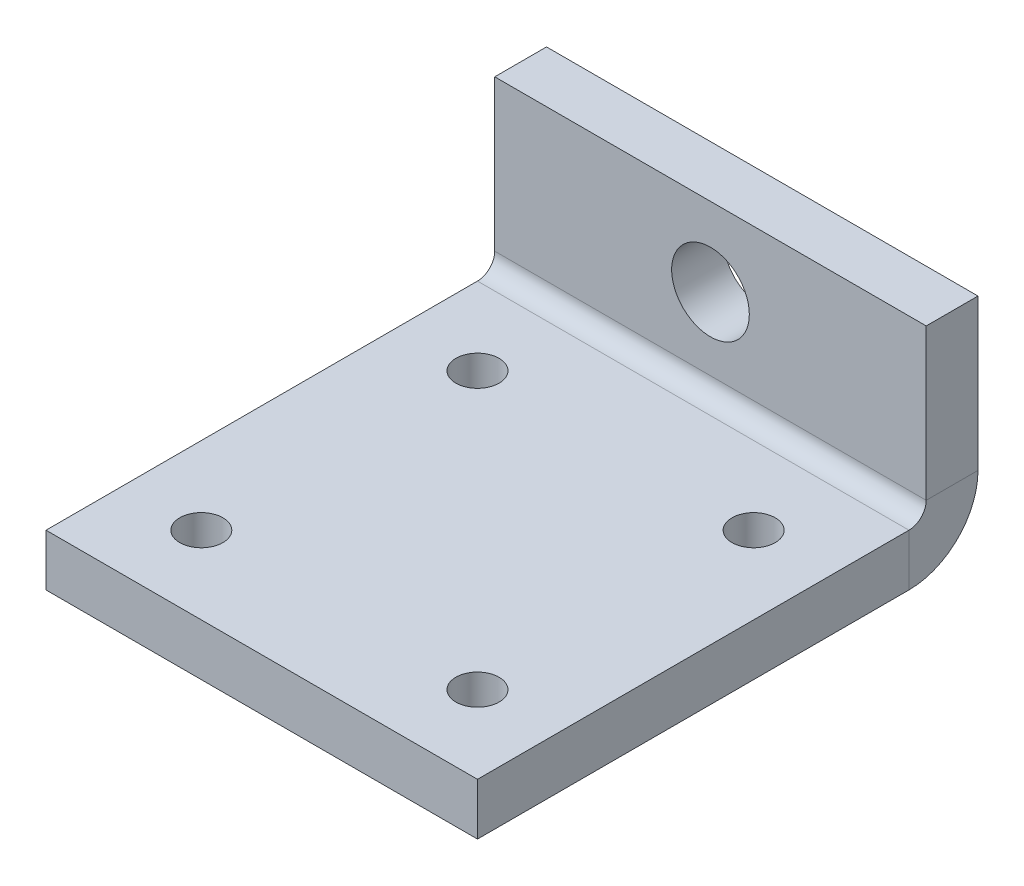
from build123d import *

# Parameters (mm, degrees)
T_LE_DE_BASE_PLI_E1_DEPTH = 25
TROU_TARAUD_M31_D         = 2.5
D_GAGEMENT_M41_D          = 4.5


# Sheet-metal steps are written as plain solids
with BuildPart() as part:
    # Esquisse1 → Tôle de base pliée1 (new body)
    with BuildSketch(Plane(origin=(0, 0, 0), x_dir=(0, 0, -1), z_dir=(1, 0, 0))):
        with BuildLine():
            Line((0, 12.75), (0, 4))
            ThreePointArc((0, 4), (-1.171572875, 1.171572875), (-4, 0))
            Line((-4, 0), (-29, 0))
            Line((-29, 0), (-29, 3))
            Line((-29, 3), (-4, 3))
            ThreePointArc((-4, 3), (-3.292893219, 3.292893219), (-3, 4))
            Line((-3, 4), (-3, 12.75))
            Line((-3, 12.75), (0, 12.75))
        make_face()
    extrude(amount=T_LE_DE_BASE_PLI_E1_DEPTH)

    # Trou taraudé M31 (through all)
    with Locations(Plane(origin=(0, 3, 0), x_dir=(1, 0, 0), z_dir=(0, 1, 0))):
        with Locations((4.5, -24.5), (4.5, -8.5), (20.5, -8.5), (20.5, -24.5)):
            Hole(TROU_TARAUD_M31_D / 2)

    # Dégagement M41 (through all)
    with Locations(Plane.XY.offset(3)):
        with Locations((12.5, 8.2)):
            Hole(D_GAGEMENT_M41_D / 2)


solid = part.part
